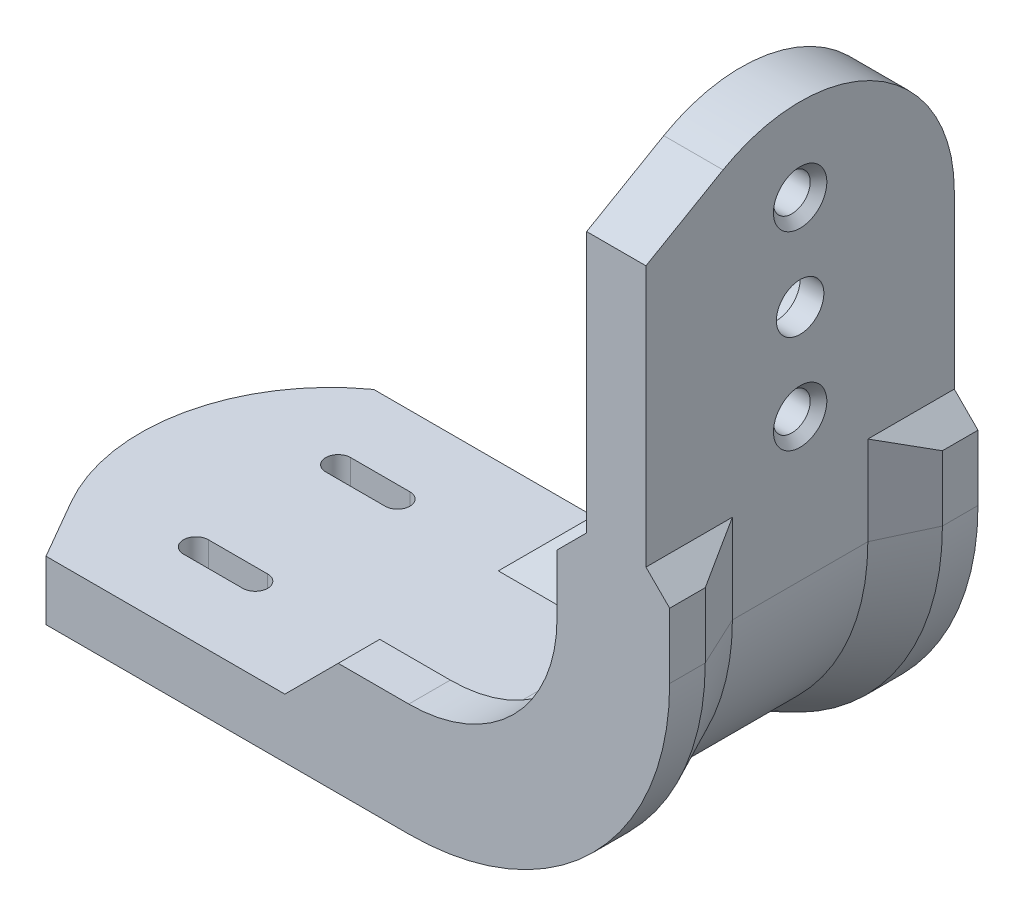
from build123d import *
from OCP.BRepFilletAPI import BRepFilletAPI_MakeChamfer

# Parameters (mm, degrees)
BOSS_EXTRUDE1_DEPTH = 7
SKETCH2_R           = 2
SKETCH2_R_2         = 1.55
BOSS_EXTRUDE2_DEPTH = 7
BOSS_EXTRUDE3_START = -13
BOSS_EXTRUDE3_DEPTH = 26
CUT_EXTRUDE3_DEPTH  = 77.816681
CUT_EXTRUDE6_DEPTH  = 10
CUT_EXTRUDE8_START  = -2
CUT_EXTRUDE8_DEPTH  = 2
CUT_EXTRUDE10_START = 2
CUT_EXTRUDE10_DEPTH = 2
SKETCH17_W          = 3
SKETCH17_H          = 2.5
SWEEP1_START        = -13
SWEEP1_DEPTH        = 3
CHAMFER3_SIZE       = 4.289014
CHAMFER3_SIZE_2     = 2
CHAMFER1_SIZE       = 0.7
CHAMFER7_SIZE       = 2.5
CHAMFER8_SIZE       = 4.289014
CHAMFER8_SIZE_2     = 2
CHAMFER9_SIZE       = 5
SKETCH14_R          = 4
CUT_EXTRUDE12_DEPTH = 2
CHAMFER11_SIZE2     = 2
CHAMFER11_SIZE      = 1
CHAMFER12_SIZE      = 3
CHAMFER13_SIZE      = 5


# Read off the part's stored shape, not the designer's step: Sweep1
# Some blends are built 0.0001 mm under size
with BuildPart() as part:
    # Sketch1 → Boss-Extrude1 (new body)
    # profile 1 of 2: a face of its own
    with BuildSketch(Plane(origin=(0, 0, 0), x_dir=(1, 0, 0), z_dir=(0, 1, 0))):
        with BuildLine():
            Line((-6.5, 13), (37.45, 13))
            Line((37.45, 13), (37.45, -13))
            Line((37.45, -13), (0, -13))
            Line((0, -13), (-8.142276, -13))
            Line((-8.142276, -13), (-11.029027, -8))
            ThreePointArc((-11.029027, -8), (-12.813017, 3.373132), (-6.5, 13))
        make_face()
        with BuildLine():
            ThreePointArc((-2.5, 2), (-4.5, 0), (-2.5, -2))
            Line((-2.5, -2), (2.5, -2))
            ThreePointArc((2.5, -2), (4.5, 0), (2.5, 2))
            Line((2.5, 2), (-2.5, 2))
        make_face(mode=Mode.SUBTRACT)
        with BuildLine():
            ThreePointArc((2.5, -7.05), (3.55, -6), (2.5, -4.95))
            Line((2.5, -4.95), (-2.5, -4.95))
            ThreePointArc((-2.5, -4.95), (-3.55, -6), (-2.5, -7.05))
            Line((-2.5, -7.05), (2.5, -7.05))
        make_face(mode=Mode.SUBTRACT)
        with BuildLine():
            ThreePointArc((2.5, 4.95), (3.55, 6), (2.5, 7.05))
            Line((2.5, 7.05), (-2.5, 7.05))
            ThreePointArc((-2.5, 7.05), (-3.55, 6), (-2.5, 4.95))
            Line((-2.5, 4.95), (2.5, 4.95))
        make_face(mode=Mode.SUBTRACT)
    # profile 2 of 2: a face of its own
    with BuildSketch(Plane(origin=(0, 0, 0), x_dir=(1, 0, 0), z_dir=(0, 1, 0))):
        with BuildLine():
            Line((2.5, 2), (-2.5, 2))
            ThreePointArc((-2.5, 2), (-4.5, 0), (-2.5, -2))
            Line((-2.5, -2), (2.5, -2))
            ThreePointArc((2.5, -2), (4.5, 0), (2.5, 2))
        make_face()
    extrude(amount=BOSS_EXTRUDE1_DEPTH)

    # Sketch2 → Boss-Extrude2 (add)
    with BuildSketch(Plane(origin=(37.45, 0, 0), x_dir=(0, 0, -1), z_dir=(1, 0, 0))):
        with BuildLine():
            Line((-13, 51.505553), (-13, 0))
            Line((-13, 0), (13, 0))
            Line((13, 0), (13, 44))
            ThreePointArc((13, 44), (6.5, 55.25833), (-6.5, 55.25833))
            Line((-6.5, 55.25833), (-13, 51.505553))
        make_face()
        with Locations((0, 42)):
            Circle(SKETCH2_R, mode=Mode.SUBTRACT)
        with Locations((0, 50)):
            Circle(SKETCH2_R_2, mode=Mode.SUBTRACT)
        with Locations((0, 34)):
            Circle(SKETCH2_R_2, mode=Mode.SUBTRACT)
    extrude(amount=BOSS_EXTRUDE2_DEPTH)

    # Sketch3 → Boss-Extrude3 (add)
    with BuildSketch(Plane.XY.offset(BOSS_EXTRUDE3_START)):
        with BuildLine():
            Line((22.45, 7), (37.45, 7))
            Line((37.45, 7), (37.45, 22))
            ThreePointArc((37.45, 22), (33.056602, 11.393398), (22.45, 7))
        make_face()
    extrude(amount=BOSS_EXTRUDE3_DEPTH)

    # Sketch6 → Cut-Extrude3 (cut, through all)
    with BuildSketch(Plane(origin=(0, 0, -13), x_dir=(-1, 0, 0), z_dir=(0, 0, -1))):
        with BuildLine():
            Line((-22.45, 0), (-44.45, 0))
            Line((-44.45, 0), (-44.45, 22))
            ThreePointArc((-44.45, 22), (-38.006349, 6.443651), (-22.45, 0))
        make_face()
    extrude(amount=-CUT_EXTRUDE3_DEPTH, mode=Mode.SUBTRACT)

    # Sketch8 → Cut-Extrude6 (cut, symmetric)
    with BuildSketch(Plane(origin=(0, 0, 0), x_dir=(-1, 0, 0), z_dir=(0, 0, -1))):
        with BuildLine():
            Line((-37.45, 22), (-37.45, 30))
            Line((-37.45, 30), (-39.45, 30))
            Line((-39.45, 30), (-39.45, 22))
            ThreePointArc((-39.45, 22), (-34.470815, 9.979185), (-22.45, 5))
            Line((-22.45, 5), (-11.5, 5))
            Line((-11.5, 5), (-11.5, 7))
            Line((-11.5, 7), (-22.45, 7))
            ThreePointArc((-22.45, 7), (-33.056602, 11.393398), (-37.45, 22))
        make_face()
        with BuildLine():
            Line((-11.5, 0), (-22.45, 0))
            ThreePointArc((-22.45, 0), (-38.006349, 6.443651), (-44.45, 22))
            Line((-44.45, 22), (-44.45, 30))
            Line((-44.45, 30), (-42.45, 30))
            Line((-42.45, 30), (-42.45, 22))
            ThreePointArc((-42.45, 22), (-36.592136, 7.857864), (-22.45, 2))
            Line((-22.45, 2), (-11.5, 2))
            Line((-11.5, 2), (-11.5, 0))
        make_face()
    extrude(amount=CUT_EXTRUDE6_DEPTH, both=True, mode=Mode.SUBTRACT)

    # Sketch10 → Cut-Extrude8 (cut)
    with BuildSketch(Plane(origin=(0, 7, 0), x_dir=(1, 0, 0), z_dir=(0, 1, 0)).offset(CUT_EXTRUDE8_START)):
        with BuildLine():
            Line((11.5, 10), (11.5, 13))
            Line((11.5, 13), (-6.5, 13))
            ThreePointArc((-6.5, 13), (-12.813017, 3.373132), (-11.029027, -8))
            Line((-11.029027, -8), (-8.142276, -13))
            Line((-8.142276, -13), (11.5, -13))
            Line((11.5, -13), (11.5, -10))
            Line((11.5, -10), (11.5, 10))
        make_face()
    extrude(amount=CUT_EXTRUDE8_DEPTH, mode=Mode.SUBTRACT)

    # Sketch12 → Cut-Extrude10 (cut)
    with BuildSketch(Plane.ZY.offset(-44.45).offset(CUT_EXTRUDE10_START)):
        with BuildLine():
            Line((-13, 30), (13, 30))
            Line((13, 30), (13, 51.505553))
            Line((13, 51.505553), (6.5, 55.25833))
            ThreePointArc((6.5, 55.25833), (-6.5, 55.25833), (-13, 44))
            Line((-13, 44), (-13, 30))
        make_face()
    extrude(amount=-CUT_EXTRUDE10_DEPTH, mode=Mode.SUBTRACT)

    # Sweep2: sweep along a path in Sketch18
    with BuildLine(Plane.XY.offset(13)) as sweep2_path:
        Line((11.5, 7), (22.45, 7))
        ThreePointArc((22.45, 7), (33.056602, 11.393398), (37.45, 22))
        Line((37.45, 22), (37.45, 30))
    # Sketch17 → Sweep2 (sweep)
    with BuildSketch(Plane.ZY.offset(-11.5)):
        with Locations((11.5, 8.25)):
            Rectangle(SKETCH17_W, SKETCH17_H)
    sweep(path=sweep2_path.line)

    # Sweep1 outline → Sweep1 (add)
    with BuildSketch(Plane.XY.offset(SWEEP1_START)):
        with BuildLine():
            Line((22.45, 9.5), (11.5, 9.5))
            Line((11.5, 9.5), (11.5, 7))
            Line((11.5, 7), (22.45, 7))
            ThreePointArc((22.45, 7), (33.056602, 11.393398), (37.45, 22))
            Line((37.45, 22), (37.45, 30))
            Line((37.45, 30), (34.95, 30))
            Line((34.95, 30), (34.95, 22))
            ThreePointArc((34.95, 22), (31.288835, 13.161165), (22.45, 9.5))
        make_face()
    extrude(amount=SWEEP1_DEPTH)

    # Chamfer3
    chamfer3_edges_1 = [part.edges().sort_by_distance(p)[0] for p in [
        (42.45, 26, 10),
    ]]
    chamfer3_side_1 = [part.faces().sort_by_distance(p)[0] for p in [
        (42.45, 26, 9.96),
    ]]
    chamfer3_edges_2 = [part.edges().sort_by_distance(p)[0] for p in [
        (16.975, 2, 10),
    ]]
    chamfer3_side_2 = [part.faces().sort_by_distance(p)[0] for p in [
        (16.975, 1.96, 10),
    ]]
    chamfer3_edges_3 = [part.edges().sort_by_distance(p)[0] for p in [
        (36.592136, 7.857864, 10),
    ]]
    chamfer3_side_3 = [part.faces().sort_by_distance(p)[0] for p in [
        (36.62042, 7.82958, 10),
    ]]
    chamfer3 = BRepFilletAPI_MakeChamfer(part.part.solid().wrapped)
    for e in chamfer3_edges_1:
        chamfer3.Add(CHAMFER3_SIZE - 0.0001, CHAMFER3_SIZE_2 - 0.0001, e.wrapped, chamfer3_side_1[0].wrapped)
    for e in chamfer3_edges_2:
        chamfer3.Add(CHAMFER3_SIZE_2 - 0.0001, CHAMFER3_SIZE - 0.0001, e.wrapped, chamfer3_side_2[0].wrapped)
    for e in chamfer3_edges_3:
        chamfer3.Add(CHAMFER3_SIZE_2 - 0.0001, CHAMFER3_SIZE - 0.0001, e.wrapped, chamfer3_side_3[0].wrapped)
    add(Compound.cast(chamfer3.Shape()), mode=Mode.REPLACE)  # a hair under: the kernel refuses the full size

    # Chamfer4
    # the kernel refuses this chamfer: 5 mm, written as the material it adds along each edge
    with BuildSketch(Plane(origin=(39.45, 30, -10), x_dir=(-0.9996219169112968, 0, -0.027495876610586317), z_dir=(0, -1, 0))) as chamfer4_piece_1_section:
        with BuildLine():
            Line((5.143366, 0), (-0.282736, -5.135589))
            Line((-0.282736, -5.135589), (-0.382698, -5.132839))
            ThreePointArc((-0.382698, -5.132839), (-0.170646, -2.566989), (-0.099962, 0.00275))
            Line((-0.099962, 0.00275), (0.00275, 0.099962))
            ThreePointArc((0.00275, 0.099962), (2.572488, 0.029278), (5.146116, 0.099962))
            Line((5.146116, 0.099962), (5.143366, 0))
        make_face()
    chamfer4_piece_1 = extrude(amount=8, mode=Mode.PRIVATE)
    chamfer4_piece_1 = split(chamfer4_piece_1, bisect_by=Plane(origin=(34.95, 26, -8.320496), z_dir=(1, 0, 0)), keep=Keep.TOP, mode=Mode.PRIVATE)
    add(chamfer4_piece_1)
    with BuildSketch(Plane(origin=(22.45, 22, -10), x_dir=(1, 0, 0), z_dir=(0, 1, 0))) as chamfer4_piece_2_section:
        with BuildLine():
            Line((11.858579, 0.141421), (17.141421, -5.141421))
            Line((17.141421, -5.141421), (17.241421, -5.141421))
            ThreePointArc((17.241421, -5.141421), (17.1, -2.570711), (17.1, 0))
            Line((17.1, 0), (17, 0.1))
            ThreePointArc((17, 0.1), (14.429289, 0.1), (11.858579, 0.241421))
            Line((11.858579, 0.241421), (11.858579, 0.141421))
        make_face()
    chamfer4_piece_2 = revolve(axis=Axis((22.45, 22, -10), (0, 0, -1)), revolution_arc=90, mode=Mode.PRIVATE)
    chamfer4_piece_2 = chamfer4_piece_2 - Plane(origin=(22.45, 22, -8.725306), x_dir=(1.0, 4.5928914007453734e-11, 0), z_dir=(0, 0, -1)) * Cylinder(12.5, 69, mode=Mode.PRIVATE)
    add(chamfer4_piece_2)
    with BuildSketch(Plane(origin=(22.45, 5, -10), x_dir=(0, -0.02749587661058649, 0.9996219169112968), z_dir=(-1, 0, 0))) as chamfer4_piece_3_section:
        with BuildLine():
            Line((5.143366, 0), (-0.282736, 5.135589))
            Line((-0.282736, 5.135589), (-0.382698, 5.132839))
            ThreePointArc((-0.382698, 5.132839), (-0.170646, 2.566989), (-0.099962, -0.00275))
            Line((-0.099962, -0.00275), (0.00275, -0.099962))
            ThreePointArc((0.00275, -0.099962), (2.572488, -0.029278), (5.146116, -0.099962))
            Line((5.146116, -0.099962), (5.143366, 0))
        make_face()
    chamfer4_piece_3 = extrude(amount=10.95, mode=Mode.PRIVATE)
    chamfer4_piece_3 = split(chamfer4_piece_3, bisect_by=Plane(origin=(16.975, 9.5, -8.320496), z_dir=(0, -1, 0)), keep=Keep.TOP, mode=Mode.PRIVATE)
    add(chamfer4_piece_3)

    # Chamfer1
    chamfer1_edges = [part.edges().sort_by_distance(p)[0] for p in [
        (42.45, 34, 1.55),
        (42.45, 50, 1.55),
    ]]
    chamfer(chamfer1_edges, length=CHAMFER1_SIZE)

    # Chamfer7
    # the kernel refuses this chamfer: 2.5 mm, written as the material it takes off along each edge
    with BuildSketch(Plane(origin=(44.45, 30, 3.570793), x_dir=(-0.9996219169112968, 0.027495876610586282, 0), z_dir=(0, 0, 1))) as chamfer7_piece_1_section:
        Polygon((CHAMFER7_SIZE * 0.999621916911, CHAMFER7_SIZE * 0.0274958766106), (-CHAMFER7_SIZE * 0.0274958766106, CHAMFER7_SIZE * 0.999621916911), (0, 0), align=None)
    chamfer7_piece_1 = extrude(amount=15.858415, mode=Mode.PRIVATE)
    chamfer7_piece_1 = split(chamfer7_piece_1, bisect_by=Plane(origin=(42.45, 29.135704, 11.5), z_dir=(1, 0, 0)), keep=Keep.TOP, mode=Mode.PRIVATE)
    add(chamfer7_piece_1, mode=Mode.SUBTRACT)
    with BuildSketch(Plane(origin=(44.45, 30, -19.429207), x_dir=(-0.9996219169112968, 0.027495876610586282, 0), z_dir=(0, 0, 1))) as chamfer7_piece_2_section:
        Polygon((CHAMFER7_SIZE * 0.999621916911, CHAMFER7_SIZE * 0.0274958766106), (-CHAMFER7_SIZE * 0.0274958766106, CHAMFER7_SIZE * 0.999621916911), (0, 0), align=None)
    chamfer7_piece_2 = extrude(amount=15.858415, mode=Mode.PRIVATE)
    chamfer7_piece_2 = split(chamfer7_piece_2, bisect_by=Plane(origin=(42.45, 29.135704, -11.5), z_dir=(1, 0, 0)), keep=Keep.TOP, mode=Mode.PRIVATE)
    add(chamfer7_piece_2, mode=Mode.SUBTRACT)

    # Chamfer8
    chamfer8_edges_1 = [part.edges().sort_by_distance(p)[0] for p in [
        (42.45, 25.75, -10),
    ]]
    chamfer8_side_1 = [part.faces().sort_by_distance(p)[0] for p in [
        (42.45, 25.75, -9.96),
    ]]
    chamfer8_edges_2 = [part.edges().sort_by_distance(p)[0] for p in [
        (16.975, 2, -10),
    ]]
    chamfer8_side_2 = [part.faces().sort_by_distance(p)[0] for p in [
        (16.975, 2, -9.96),
    ]]
    chamfer8_edges_3 = [part.edges().sort_by_distance(p)[0] for p in [
        (36.592136, 7.857864, -10),
    ]]
    chamfer8_side_3 = [part.faces().sort_by_distance(p)[0] for p in [
        (36.62042, 7.82958, -10),
    ]]
    chamfer8 = BRepFilletAPI_MakeChamfer(part.part.solid().wrapped)
    for e in chamfer8_edges_1:
        chamfer8.Add(CHAMFER8_SIZE - 0.0001, CHAMFER8_SIZE_2 - 0.0001, e.wrapped, chamfer8_side_1[0].wrapped)
    for e in chamfer8_edges_2:
        chamfer8.Add(CHAMFER8_SIZE - 0.0001, CHAMFER8_SIZE_2 - 0.0001, e.wrapped, chamfer8_side_2[0].wrapped)
    for e in chamfer8_edges_3:
        chamfer8.Add(CHAMFER8_SIZE_2 - 0.0001, CHAMFER8_SIZE - 0.0001, e.wrapped, chamfer8_side_3[0].wrapped)
    add(Compound.cast(chamfer8.Shape()), mode=Mode.REPLACE)  # a hair under: the kernel refuses the full size

    # Chamfer9
    # the kernel refuses this chamfer: 5 mm, written as the material it adds along each edge
    with BuildSketch(Plane(origin=(39.45, 30, 10), x_dir=(-0.9996219169112968, 0, 0.027495876610586317), z_dir=(0, -1, 0))) as chamfer9_piece_1_section:
        Polygon((CHAMFER9_SIZE * 0.999621916911, CHAMFER9_SIZE * 0.0274958766106), (-CHAMFER9_SIZE * 0.0274958766106, CHAMFER9_SIZE * 0.999621916911), (0, 0), align=None)
    chamfer9_piece_1 = extrude(amount=8, mode=Mode.PRIVATE)
    chamfer9_piece_1 = split(chamfer9_piece_1, bisect_by=Plane(origin=(34.95, 27.933854, 7.772938), z_dir=(1, 0, 0)), keep=Keep.TOP, mode=Mode.PRIVATE)
    add(chamfer9_piece_1)
    with BuildSketch(Plane(origin=(22.45, 5, 10), x_dir=(0, 0.9996219169112968, 0.027495876610586324), z_dir=(-1, 0, 0))) as chamfer9_piece_2_section:
        Polygon((CHAMFER9_SIZE * 0.999621916911, CHAMFER9_SIZE * 0.0274958766106), (-CHAMFER9_SIZE * 0.0274958766106, CHAMFER9_SIZE * 0.999621916911), (0, 0), align=None)
    chamfer9_piece_2 = extrude(amount=10.95, mode=Mode.PRIVATE)
    chamfer9_piece_2 = split(chamfer9_piece_2, bisect_by=Plane(origin=(18.429736, 9.5, 8.798086), z_dir=(0, -1, 0)), keep=Keep.TOP, mode=Mode.PRIVATE)
    add(chamfer9_piece_2)
    with BuildSketch(Plane(origin=(22.45, 22, 10), x_dir=(1, 0, 0), z_dir=(0, 1, 0))) as chamfer9_piece_3_section:
        Polygon((17 - CHAMFER9_SIZE, 0), (17, CHAMFER9_SIZE), (17, 0), align=None)
    chamfer9_piece_3 = revolve(axis=Axis((22.45, 22, 10), (0, 0, -1)), revolution_arc=90, mode=Mode.PRIVATE)
    chamfer9_piece_3 = chamfer9_piece_3 - Plane(origin=(22.45, 22, 8.660678), x_dir=(0, -1, 0), z_dir=(0, 0, -1)) * Cylinder(12.5, 69, mode=Mode.PRIVATE)
    add(chamfer9_piece_3)

    # Sketch14 → Cut-Extrude12 (cut)
    with BuildSketch(Plane(origin=(37.45, 0, 0), x_dir=(0, 0, -1), z_dir=(1, 0, 0))):
        with Locations(Location((0, 42, 0), (0, 0, 180))):
            Circle(SKETCH14_R)
    extrude(amount=CUT_EXTRUDE12_DEPTH, mode=Mode.SUBTRACT)

    # Chamfer11
    chamfer11_edges = [part.edges().sort_by_distance(p)[0] for p in [
        (39.45, 42, 2),
    ]]
    chamfer11_side = [part.faces().sort_by_distance(p)[0] for p in [
        (39.47, 42, 2),
    ]]
    chamfer(chamfer11_edges, length=CHAMFER11_SIZE - 0.0001, length2=CHAMFER11_SIZE2 - 0.0001, reference=chamfer11_side[0])  # a hair under: the kernel refuses the full size

    # Chamfer12
    # the kernel refuses this chamfer: 3 mm, written as the material it takes off along each edge
    with BuildSketch(Plane(origin=(34.95, 30, -20.715049), x_dir=(-0.027495876610586768, -0.9996219169112968, 0), z_dir=(0, 0, 1))) as chamfer12_piece_1_section:
        Polygon((CHAMFER12_SIZE * 0.999621916911, CHAMFER12_SIZE * 0.0274958766106), (-CHAMFER12_SIZE * 0.0274958766106, CHAMFER12_SIZE * 0.999621916911), (0, 0), align=None)
    chamfer12_piece_1 = extrude(amount=18.930098, mode=Mode.PRIVATE)
    chamfer12_piece_1 = split(chamfer12_piece_1, bisect_by=Plane(origin=(37.45, 28.97392, -11.25), z_dir=(-1, 0, 0)), keep=Keep.TOP, mode=Mode.PRIVATE)
    add(chamfer12_piece_1, mode=Mode.SUBTRACT)
    with BuildSketch(Plane(origin=(34.95, 30, 1.784951), x_dir=(0.9996219169112965, 0.02749587661058676, 1.4233391824783543e-14), z_dir=(0, 0, 1))) as chamfer12_piece_2_section:
        Polygon((CHAMFER12_SIZE * 0.999621916911, -CHAMFER12_SIZE * 0.0274958766106), (-CHAMFER12_SIZE * 0.0274958766106, -CHAMFER12_SIZE * 0.999621916911), (0, 0), align=None)
    chamfer12_piece_2 = extrude(amount=18.930098, mode=Mode.PRIVATE)
    chamfer12_piece_2 = split(chamfer12_piece_2, bisect_by=Plane(origin=(37.45, 28.97392, 11.25), z_dir=(-1, 0, 0)), keep=Keep.TOP, mode=Mode.PRIVATE)
    add(chamfer12_piece_2, mode=Mode.SUBTRACT)

    # Chamfer13
    # the kernel refuses this chamfer: 5 mm, written as the material it takes off along each edge
    with BuildSketch(Plane(origin=(11.5, 9.5, 25.858415), x_dir=(0.9996219169112968, 0.027495876610586317, 1.5220159105039985e-15), z_dir=(0, 0, -1))) as chamfer13_piece_1_section:
        Polygon((CHAMFER13_SIZE * 0.999621916911, CHAMFER13_SIZE * 0.0274958766106), (-CHAMFER13_SIZE * 0.0274958766106, CHAMFER13_SIZE * 0.999621916911), (0, 0), align=None)
    chamfer13_piece_1 = extrude(amount=29.21683, mode=Mode.PRIVATE)
    chamfer13_piece_1 = split(chamfer13_piece_1, bisect_by=Plane(origin=(13.179504, 5, 11.25), z_dir=(0, 1, 0)), keep=Keep.TOP, mode=Mode.PRIVATE)
    add(chamfer13_piece_1, mode=Mode.SUBTRACT)
    with BuildSketch(Plane(origin=(11.5, 9.5, -25.858415), x_dir=(-0.027495876610586317, -0.9996219169112968, 0), z_dir=(0, 0, 1))) as chamfer13_piece_2_section:
        Polygon((CHAMFER13_SIZE * 0.999621916911, CHAMFER13_SIZE * 0.0274958766106), (-CHAMFER13_SIZE * 0.0274958766106, CHAMFER13_SIZE * 0.999621916911), (0, 0), align=None)
    chamfer13_piece_2 = extrude(amount=29.21683, mode=Mode.PRIVATE)
    chamfer13_piece_2 = split(chamfer13_piece_2, bisect_by=Plane(origin=(13.179504, 5, -11.25), z_dir=(0, 1, 0)), keep=Keep.TOP, mode=Mode.PRIVATE)
    add(chamfer13_piece_2, mode=Mode.SUBTRACT)


solid = part.part
